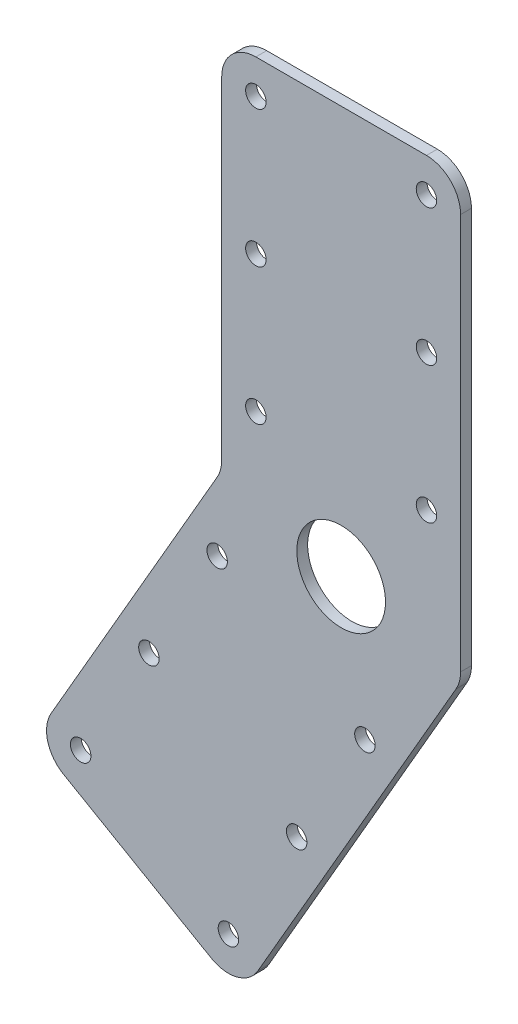
from build123d import *

# Parameters (mm, degrees)
SKETCH1_R           = 6.5
SKETCH1_R_2         = 1.5
BOSS_EXTRUDE1_DEPTH = 1.5875
FILLET1_R           = 5


with BuildPart() as part:
    # Sketch1 → Boss-Extrude1 (new body)
    with BuildSketch(Plane.XY):
        Polygon((0, 0), (0, 55), (35, 55), (35, -9.378221735), (2.810889132, -65.131397208), (-27.5, -47.631397208), align=None)
        with Locations((17.5, -4.689110868)):
            Circle(SKETCH1_R, mode=Mode.SUBTRACT)
        with Locations((5, 50)):
            Circle(SKETCH1_R_2, mode=Mode.SUBTRACT)
        with Locations((5, 30)):
            Circle(SKETCH1_R_2, mode=Mode.SUBTRACT)
        with Locations((5, 10)):
            Circle(SKETCH1_R_2, mode=Mode.SUBTRACT)
        with Locations((30, 10)):
            Circle(SKETCH1_R_2, mode=Mode.SUBTRACT)
        with Locations((30, 30)):
            Circle(SKETCH1_R_2, mode=Mode.SUBTRACT)
        with Locations((30, 50)):
            Circle(SKETCH1_R_2, mode=Mode.SUBTRACT)
        with Locations((-20.669872981, -45.801270189)):
            Circle(SKETCH1_R_2, mode=Mode.SUBTRACT)
        with Locations((-10.669872981, -28.480762114)):
            Circle(SKETCH1_R_2, mode=Mode.SUBTRACT)
        with Locations((-0.669872981, -11.160254038)):
            Circle(SKETCH1_R_2, mode=Mode.SUBTRACT)
        with Locations((20.980762114, -23.660254038)):
            Circle(SKETCH1_R_2, mode=Mode.SUBTRACT)
        with Locations((10.980762114, -40.980762114)):
            Circle(SKETCH1_R_2, mode=Mode.SUBTRACT)
        with Locations((0.980762114, -58.301270189)):
            Circle(SKETCH1_R_2, mode=Mode.SUBTRACT)
    extrude(amount=BOSS_EXTRUDE1_DEPTH)

    # Fillet1
    fillet1_edges = [part.edges().sort_by_distance(p)[0] for p in [
        (35, -9.378221735, 0.79375),
        (0, 0, 0.79375),
        (2.810889132, -65.131397208, 0.79375),
        (-27.5, -47.631397208, 0.79375),
        (0, 55, 0.79375),
        (35, 55, 0.79375),
    ]]
    fillet(fillet1_edges, radius=FILLET1_R)


solid = part.part
